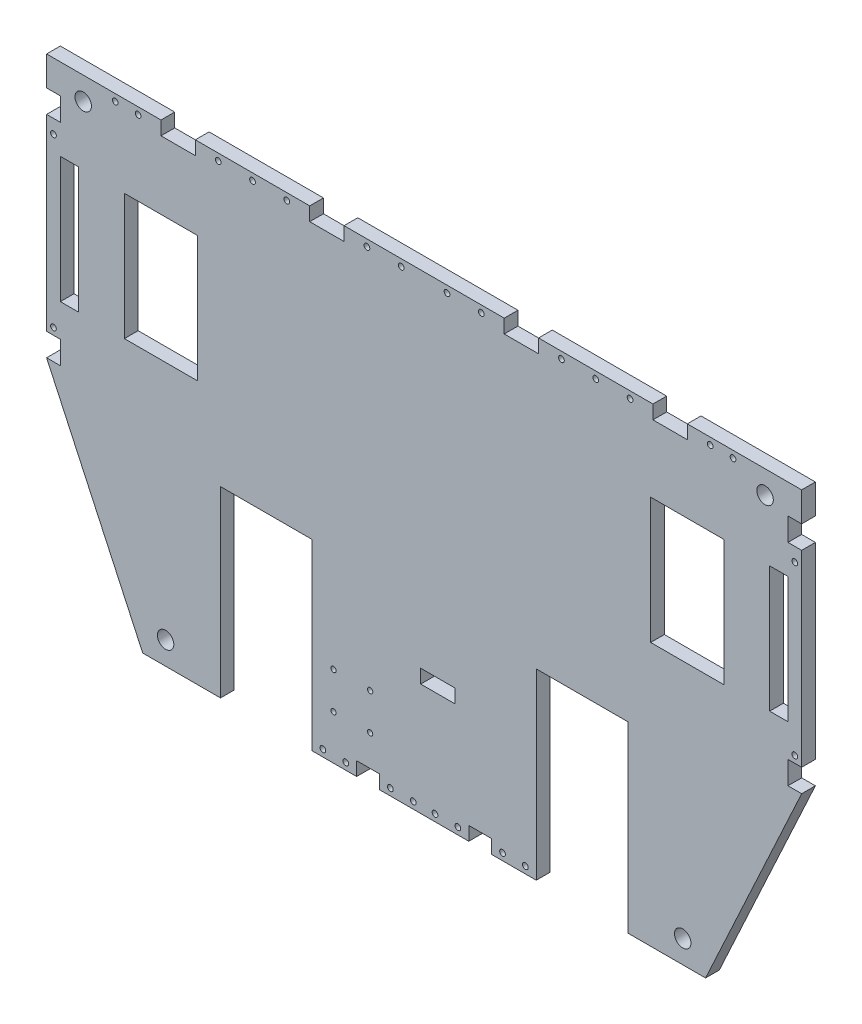
from build123d import *

# Parameters (mm, degrees)
ESQUISSE1_R             = 1.15
ESQUISSE1_W             = 15
ESQUISSE1_H             = 6
BOSS_EXTRU_1_DEPTH      = 6
ESQUISSE2_R             = 3.6
ESQUISSE2_W             = 8
ESQUISSE2_H             = 55
ESQUISSE2_W_2           = 32
ESQUISSE2_W_3           = 40
ESQUISSE2_H_2           = 80
ENL_V_MAT_EXTRU_1_DEPTH = 6
ESQUISSE3_W             = 6
ESQUISSE3_H             = 10
ESQUISSE3_W_2           = 10
ESQUISSE3_H_2           = 6
ESQUISSE3_W_3           = 15
ENL_V_MAT_EXTRU_2_DEPTH = 6
ESQUISSE4_R             = 1.25
ENL_V_MAT_EXTRU_3_DEPTH = 6


with BuildPart() as part:
    # Esquisse1 → Boss.-Extru.1 (new body)
    with BuildSketch(Plane.XY):
        Polygon((-165, 96.73), (165, 96.73), (165, -18.27), (123, -109.022410436), (-123, -109.022410436), (-165, -18.27), align=None)
        with Locations((-23.6, -89.522410436)):
            Circle(ESQUISSE1_R, mode=Mode.SUBTRACT)
        with Locations((-23.6, -73.522410436)):
            Circle(ESQUISSE1_R, mode=Mode.SUBTRACT)
        with Locations((-39.6, -89.522410436)):
            Circle(ESQUISSE1_R, mode=Mode.SUBTRACT)
        with Locations((-39.6, -73.522410436)):
            Circle(ESQUISSE1_R, mode=Mode.SUBTRACT)
        with Locations((6, -57.022410436)):
            Rectangle(ESQUISSE1_W, ESQUISSE1_H, mode=Mode.SUBTRACT)
    extrude(amount=BOSS_EXTRU_1_DEPTH)

    # Esquisse2 → Enlèv. mat.-Extru.1 (cut)
    with BuildSketch(Plane.XY.offset(6)):
        with Locations((149, 86.73)):
            Circle(ESQUISSE2_R)
        with Locations((113, -99.022410436)):
            Circle(ESQUISSE2_R)
        with Locations((-149, 86.73)):
            Circle(ESQUISSE2_R)
        with Locations((-113, -99.022410436)):
            Circle(ESQUISSE2_R)
        with Locations((-155, 33.477589564)):
            Rectangle(ESQUISSE2_W, ESQUISSE2_H)
        with Locations((-115, 33.477589564)):
            Rectangle(ESQUISSE2_W_2, ESQUISSE2_H)
        with Locations((115, 33.477589564)):
            Rectangle(ESQUISSE2_W_2, ESQUISSE2_H)
        with Locations((155, 33.477589564)):
            Rectangle(ESQUISSE2_W, ESQUISSE2_H)
        with Locations((69, -69.022410436)):
            Rectangle(ESQUISSE2_W_3, ESQUISSE2_H_2)
        with Locations((-69, -69.022410436)):
            Rectangle(ESQUISSE2_W_3, ESQUISSE2_H_2)
    extrude(amount=-ENL_V_MAT_EXTRU_1_DEPTH, mode=Mode.SUBTRACT)

    # Esquisse3 → Enlèv. mat.-Extru.2 (cut)
    with BuildSketch(Plane(origin=(0, 0, 0), x_dir=(-1, 0, 0), z_dir=(0, 0, -1))):
        with Locations((162, -13.27)):
            Rectangle(ESQUISSE3_W, ESQUISSE3_H)
        with Locations((162, 78.852589564)):
            Rectangle(ESQUISSE3_W, ESQUISSE3_H)
        with Locations((24.5, -106.022410436)):
            Rectangle(ESQUISSE3_W_2, ESQUISSE3_H_2)
        with Locations((-24.5, -106.022410436)):
            Rectangle(ESQUISSE3_W_2, ESQUISSE3_H_2)
        with Locations((-162, 78.852589564)):
            Rectangle(ESQUISSE3_W, ESQUISSE3_H)
        with Locations((-162, -13.27)):
            Rectangle(ESQUISSE3_W, ESQUISSE3_H)
        with Locations((107.5, 93.73)):
            Rectangle(ESQUISSE3_W_3, ESQUISSE3_H_2)
        with Locations((-42.5, 93.73)):
            Rectangle(ESQUISSE3_W_3, ESQUISSE3_H_2)
        with Locations((42.5, 93.73)):
            Rectangle(ESQUISSE3_W_3, ESQUISSE3_H_2)
        with Locations((-107.5, 93.73)):
            Rectangle(ESQUISSE3_W_3, ESQUISSE3_H_2)
    extrude(amount=-ENL_V_MAT_EXTRU_2_DEPTH, mode=Mode.SUBTRACT)

    # Esquisse4 → Enlèv. mat.-Extru.3 (cut)
    with BuildSketch(Plane(origin=(0, 0, 0), x_dir=(-1, 0, 0), z_dir=(0, 0, -1))):
        with Locations((162, -5.27)):
            Circle(ESQUISSE4_R)
        with Locations((162, 67.852589564)):
            Circle(ESQUISSE4_R)
        with Locations((44.25, -106.022410436)):
            Circle(ESQUISSE4_R)
        with Locations((14.75, -106.022410436)):
            Circle(ESQUISSE4_R)
        with Locations((4.75, -106.022410436)):
            Circle(ESQUISSE4_R)
        with Locations((34.249651607, -106.022410436)):
            Circle(ESQUISSE4_R)
        with Locations((135, 93.73)):
            Circle(ESQUISSE4_R)
        with Locations((125, 93.73)):
            Circle(ESQUISSE4_R)
        with Locations((90, 93.73)):
            Circle(ESQUISSE4_R)
        with Locations((75, 93.73)):
            Circle(ESQUISSE4_R)
        with Locations((60, 93.73)):
            Circle(ESQUISSE4_R)
        with Locations((25, 93.73)):
            Circle(ESQUISSE4_R)
        with Locations((10, 93.73)):
            Circle(ESQUISSE4_R)
        with Locations((-10, 93.73)):
            Circle(ESQUISSE4_R)
        with Locations((-25, 93.73)):
            Circle(ESQUISSE4_R)
        with Locations((-60, 93.73)):
            Circle(ESQUISSE4_R)
        with Locations((-75, 93.73)):
            Circle(ESQUISSE4_R)
        with Locations((-90, 93.73)):
            Circle(ESQUISSE4_R)
        with Locations((-125, 93.73)):
            Circle(ESQUISSE4_R)
        with Locations((-135, 93.73)):
            Circle(ESQUISSE4_R)
        with Locations((-34.249651607, -106.022410436)):
            Circle(ESQUISSE4_R)
        with Locations((-4.75, -106.022410436)):
            Circle(ESQUISSE4_R)
        with Locations((-14.75, -106.022410436)):
            Circle(ESQUISSE4_R)
        with Locations((-44.25, -106.022410436)):
            Circle(ESQUISSE4_R)
        with Locations((-162, 67.852589564)):
            Circle(ESQUISSE4_R)
        with Locations((-162, -5.27)):
            Circle(ESQUISSE4_R)
    extrude(amount=-ENL_V_MAT_EXTRU_3_DEPTH, mode=Mode.SUBTRACT)


solid = part.part
